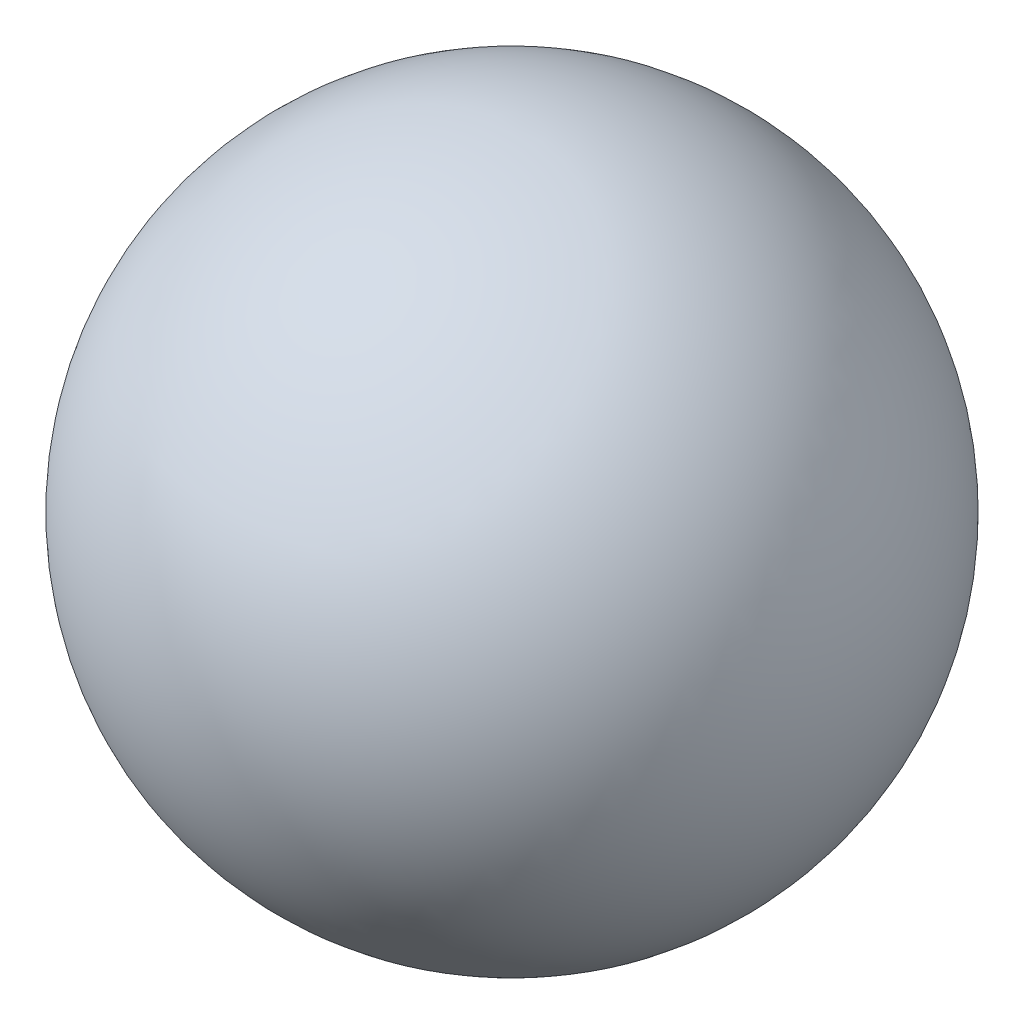
from build123d import *


with BuildPart() as part:
    # Sketch1 → Revolve2 (revolve)
    with BuildSketch(Plane.XY):
        with BuildLine():
            ThreePointArc((0, 2.5146), (-2.5146, 0), (0, -2.5146))
            Line((0, -2.5146), (0, 2.5146))
        make_face()
    revolve(axis=Axis((0, -2.5146, 0), (0, 1, 0)))


solid = part.part
